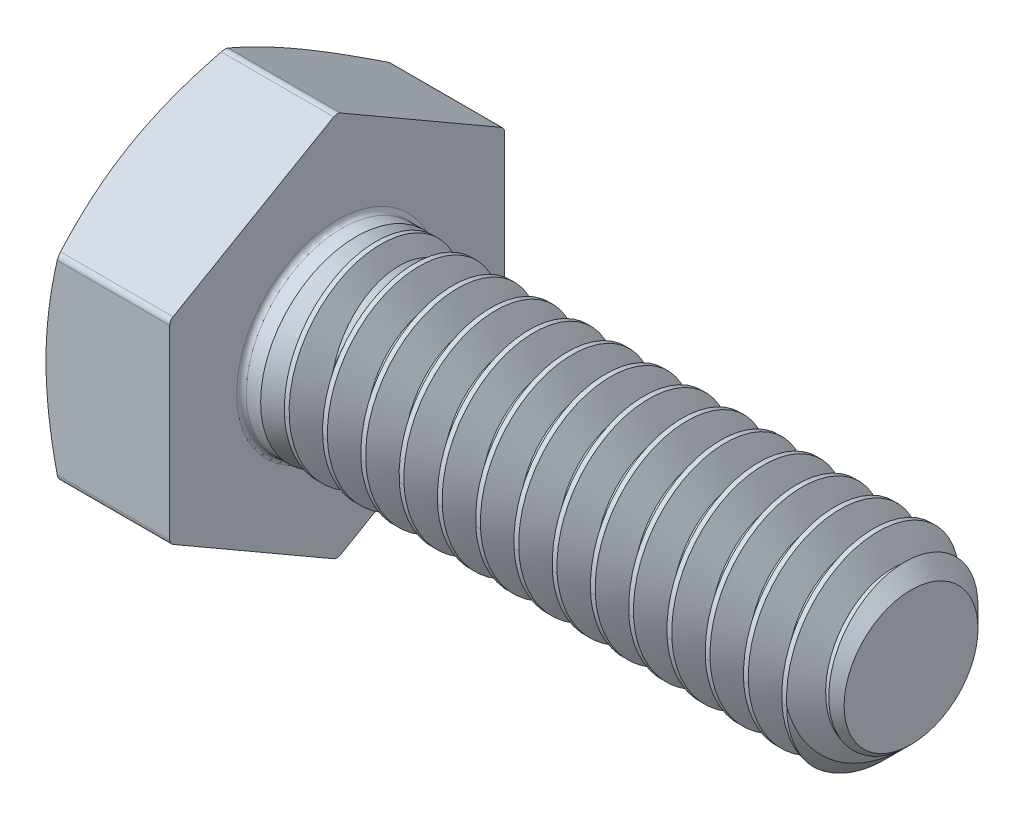
from build123d import *

# Parameters (mm, degrees)
SKETCH2_R           = 3.175
BOSS_EXTRUDE1_DEPTH = 19.05
BOSS_EXTRUDE2_DEPTH = 4.365625
SKETCH5_OUTSIDE_W   = 37.62
SKETCH5_OUTSIDE_H   = 39.34
SKETCH5_OUTSIDE_R   = 5.000625
CUT_EXTRUDE1_DEPTH  = 4.365625
CUT_EXTRUDE1_DRAFT  = -65
FILLET7_R           = 0.22225
CHAMFER1_SIZE       = 0.9525
FILLET4_R           = 0.15875
CUT_SWEEP1_PITCH    = 1.27
CUT_SWEEP1_TO       = 18.415


with BuildPart() as part:
    # Sketch2 → Boss-Extrude1 (new body)
    with BuildSketch(Plane(origin=(0, 0, 0), x_dir=(0, 0, -1), z_dir=(1, 0, 0))):
        Circle(SKETCH2_R)
    extrude(amount=BOSS_EXTRUDE1_DEPTH)

    # Sketch3 → Boss-Extrude2 (add)
    with BuildSketch(Plane.ZY):
        Polygon((0, 6.415804866), (-5.55625, 3.207902433), (-5.55625, -3.207902433), (0, -6.415804866), (5.55625, -3.207902433), (5.55625, 3.207902433), align=None)
    extrude(amount=BOSS_EXTRUDE2_DEPTH)


with BuildPart() as cut_extrude1_tool:
    # Sketch5 outside → Cut-Extrude1 (with draft: the straight prism first)
    with BuildSketch(Plane.ZY.offset(4.365625)):
        Rectangle(SKETCH5_OUTSIDE_W, SKETCH5_OUTSIDE_H)
        Circle(SKETCH5_OUTSIDE_R, mode=Mode.SUBTRACT)
    extrude(amount=-CUT_EXTRUDE1_DEPTH)
    # Cut-Extrude1: the draft: its side faces are tilted about the plane it starts from
    cut_extrude1_sides = [cut_extrude1_tool.faces().sort_by_distance(p)[0] for p in [
        (-2.1828125, -19.67, 0),
        (-2.1828125, 0, 18.81),
        (-2.1828125, 19.67, 0),
        (-2.1828125, 0, -18.81),
        (-2.1828125, 0, -5.000625),
    ]]
    draft(cut_extrude1_sides, Plane.ZY.offset(4.365625), CUT_EXTRUDE1_DRAFT)


with BuildPart() as part_1:
    add(part.part)

    # Cut-Extrude1: cut by cut_extrude1_tool
    add(cut_extrude1_tool.part, mode=Mode.SUBTRACT)

    # Fillet7
    fillet7_edges = [part_1.edges().sort_by_distance(p)[0] for p in [
        (-1.852857895, -6.415804866, 0),
        (-1.852857895, -3.207902433, -5.55625),
        (-1.852857895, 3.207902433, -5.55625),
        (-1.852857895, 6.415804866, 0),
        (-1.852857895, -3.207902433, 5.55625),
        (-1.852857895, 3.207902433, 5.55625),
    ]]
    fillet(fillet7_edges, radius=FILLET7_R)

    # Chamfer1
    chamfer1_edges = [part_1.edges().sort_by_distance(p)[0] for p in [
        (19.05, 0, 3.175),
    ]]
    chamfer(chamfer1_edges, length=CHAMFER1_SIZE)

    # Fillet4
    fillet4_edges = [part_1.edges().sort_by_distance(p)[0] for p in [
        (0, 0, 3.175),
    ]]
    fillet(fillet4_edges, radius=FILLET4_R)


with BuildPart() as body_2:
    # Split1: the piece on the far side of the plane
    add(part_1.part)
    split(bisect_by=Plane(origin=(0.635, 0, 0), x_dir=(0, 0, 1), z_dir=(1, 0, 0)), keep=Keep.BOTTOM)


with BuildPart() as part_2:
    add(part_1.part)

    # Split1
    split(bisect_by=Plane(origin=(0.635, 0, 0), x_dir=(0, 0, 1), z_dir=(1, 0, 0)), keep=Keep.TOP)

    # Cut-Sweep1: arcs per turn and ends read off the stored shape
    # Cut-Sweep1: the profile of Sketch13 screwed along a right-hand helix through 17 turns, 8 arcs to a turn; built about Z, then put on its axis
    cut_sweep1_z = Axis((0, 0, 0), (0, 0, 1))
    cut_sweep1_corners = [(2.350110803, 0, -0.635), (3.243740766, 0, -1.1509375), (3.243740766, 0, 0.0396875), (2.350110803, 0, -0.47625)]
    with BuildLine(mode=Mode.PRIVATE) as cut_sweep1_profile:
        Line(cut_sweep1_corners[0], cut_sweep1_corners[1])
        Line(cut_sweep1_corners[1], cut_sweep1_corners[2])
        Line(cut_sweep1_corners[2], cut_sweep1_corners[3])
        Line(cut_sweep1_corners[3], cut_sweep1_corners[0])
    cut_sweep1_cap = Face(cut_sweep1_profile.wire())
    cut_sweep1_turn_angles = [0, 22.5, 45, 67.5, 90, 112.5, 135, 157.5, 180, 202.5, 225, 247.5, 270, 292.5, 315, 337.5, 360]
    cut_sweep1_turn_weights = [1, 0.9238795325112867, 1, 0.9238795325112867, 1, 0.9238795325112867, 1, 0.9238795325112867, 1, 0.9238795325112867, 1, 0.9238795325112867, 1, 0.9238795325112867, 1, 0.9238795325112867, 1]
    cut_sweep1_turn_rails = [Edge.make_bspline([Vector(p[0], p[1], 0).rotate(cut_sweep1_z, cut_sweep1_turn_angles[k]) / cut_sweep1_turn_weights[k] + Vector(0, 0, p[2] + CUT_SWEEP1_PITCH * cut_sweep1_turn_angles[k] / 360) for k in range(17)], [0, 0, 0, 1, 1, 2, 2, 3, 3, 4, 4, 5, 5, 6, 6, 7, 7, 8, 8, 8], 2, cut_sweep1_turn_weights) for p in cut_sweep1_corners]
    cut_sweep1_turn_sides = [Face.make_surface_from_curves(cut_sweep1_turn_rails[p[0]], cut_sweep1_turn_rails[p[1]]) for p in [(0, 1), (1, 2), (2, 3), (3, 0)]]
    cut_sweep1 = Plane(origin=(19.05, 0, 0), x_dir=(0, 1, 0), z_dir=(-1, 0, 0)) * split(Solid(Shell([*[p.moved(Location((0, 0, CUT_SWEEP1_PITCH * i))) for i in range(17) for p in cut_sweep1_turn_sides], cut_sweep1_cap, cut_sweep1_cap.rotate(cut_sweep1_z, 6120).moved(Location((0, 0, CUT_SWEEP1_PITCH * 6120 / 360)))])), bisect_by=Plane.XY.offset(CUT_SWEEP1_TO), keep=Keep.BOTTOM, mode=Mode.PRIVATE)
    add(cut_sweep1, mode=Mode.SUBTRACT)

    add(body_2.part)  # Boss-Extrude4 merges body 2
    # Boss-Extrude4: read off the stored shape, not the designer's step
    # Boss-Extrude4 outline → Boss-Extrude4 (revolve)
    with BuildSketch(Plane.YX):
        Polygon((3.175, 0.635), (2.350107303, 1.965415723), (2.350107303, 0.635), align=None)
    revolve(axis=Axis((0, 0, 0), (1, 0, 0)))


solid = part_2.part
